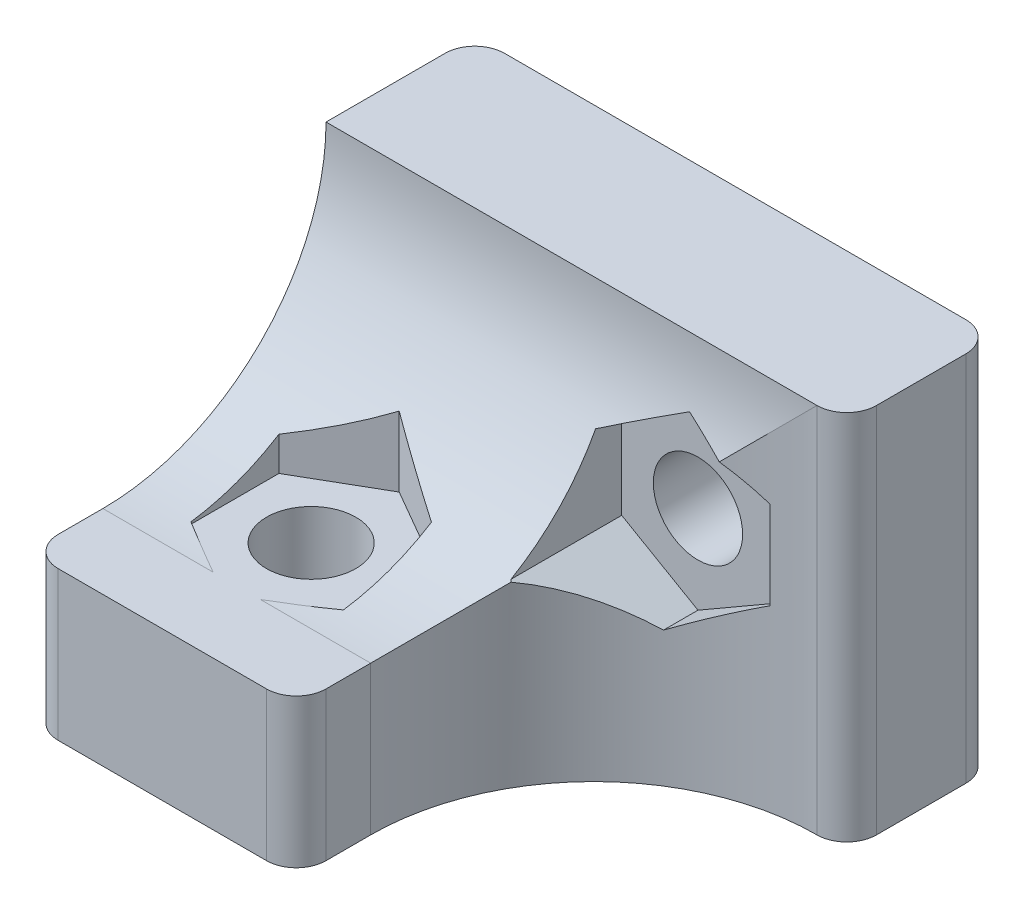
from build123d import *

# Parameters (mm, degrees)
SKETCH1_W           = 35
SKETCH1_H           = 25
BOSS_EXTRUDE1_DEPTH = 10
SKETCH2_R           = 3
CUT_EXTRUDE1_DEPTH  = 24.717082451
SKETCH3_W           = 18
SKETCH3_H           = 10
BOSS_EXTRUDE2_DEPTH = 20
SKETCH4_R           = 3
CUT_EXTRUDE2_DEPTH  = 38.831864876
FILLET2_R           = 15
FILLET3_R           = 2
CUT_EXTRUDE3_START  = -10
CUT_EXTRUDE3_DEPTH  = 27.912057753
CUT_EXTRUDE4_START  = -10
CUT_EXTRUDE4_DEPTH  = 33.793107057


# Some blends are built 0.0001 mm under size
with BuildPart() as part:
    # Sketch1 → Boss-Extrude1 (new body)
    with BuildSketch(Plane.XY):
        Rectangle(SKETCH1_W, SKETCH1_H)
    extrude(amount=BOSS_EXTRUDE1_DEPTH)

    # Sketch2 → Cut-Extrude1 (cut, through all)
    with BuildSketch(Plane.XY.offset(10)):
        with Locations((7.5, 2.5)):
            Circle(SKETCH2_R)
    extrude(amount=-CUT_EXTRUDE1_DEPTH, mode=Mode.SUBTRACT)

    # Sketch3 → Boss-Extrude2 (add)
    with BuildSketch(Plane.XY.offset(10)):
        with Locations((-8.5, -7.5)):
            Rectangle(SKETCH3_W, SKETCH3_H)
    extrude(amount=BOSS_EXTRUDE2_DEPTH)

    # Sketch4 → Cut-Extrude2 (cut, through all)
    with BuildSketch(Plane(origin=(0, -2.5, 0), x_dir=(1, 0, 0), z_dir=(0, 1, 0))):
        with Locations(Location((-8.5, -20, 0), (0, 0, 180))):
            Circle(SKETCH4_R)
    extrude(amount=-CUT_EXTRUDE2_DEPTH, mode=Mode.SUBTRACT)

    # Fillet2
    # the kernel refuses this fillet: 15 mm, written as the material it adds along each edge
    with BuildSketch(Plane(origin=(-17.5, -2.5, 10), x_dir=(0, 1, 0), z_dir=(1, 0, 0))) as fillet2_piece_1_section:
        with BuildLine():
            CenterArc((FILLET2_R, FILLET2_R), FILLET2_R, 180, 90)
            Line((0, FILLET2_R), (0, 0))
            Line((0, 0), (FILLET2_R, 0))
        make_face()
    fillet2_piece_1 = extrude(amount=18, mode=Mode.PRIVATE)
    fillet2_piece_1 = fillet2_piece_1 - Plane(origin=(-8.5, 1.000391612, 20), x_dir=(-1, 0, 0), z_dir=(0, 1, 0)) * Cylinder(3, 96, mode=Mode.PRIVATE)
    add(fillet2_piece_1)
    with BuildSketch(Plane(origin=(0.5, -2.5, 10), x_dir=(1, 0, 0), z_dir=(0, -1, 0))) as fillet2_piece_2:
        with BuildLine():
            CenterArc((FILLET2_R, FILLET2_R), FILLET2_R, 180, 90)
            Line((0, FILLET2_R), (0, 0))
            Line((0, 0), (FILLET2_R, 0))
        make_face()
    extrude(amount=10)
    with BuildSketch(Plane(origin=(-17.5, -2.5, 10), x_dir=(0, 1, 0), z_dir=(1, 0, 0))) as fillet2_piece_3a_section:
        with BuildLine():
            CenterArc((FILLET2_R, FILLET2_R), FILLET2_R, 180, 90)
            Line((0, FILLET2_R), (0, 0))
            Line((0, 0), (FILLET2_R, 0))
        make_face()
    fillet2_piece_3a = extrude(amount=55.5, mode=Mode.PRIVATE)
    fillet2_piece_3a = split(fillet2_piece_3a, bisect_by=Plane(origin=(17.5, 8.593163467, 10.419487564), z_dir=(-1, 0, 0)), keep=Keep.TOP, mode=Mode.PRIVATE)
    fillet2_piece_3a = fillet2_piece_3a - Plane(origin=(7.5, 2.5, 10.419487564), x_dir=(1, 0, 0), z_dir=(0, 0, 1)) * Cylinder(3, 171, mode=Mode.PRIVATE)
    fillet2_piece_3a = split(fillet2_piece_3a, bisect_by=Plane(origin=(0.5, 8.593163467, 10.419487564), z_dir=(1, 0, 0)), keep=Keep.TOP, mode=Mode.PRIVATE)
    with BuildSketch(Plane(origin=(0.5, 35, 10), x_dir=(1, 0, 0), z_dir=(0, -1, 0))) as fillet2_piece_3b_section:
        with BuildLine():
            CenterArc((FILLET2_R, FILLET2_R), FILLET2_R, 180, 90)
            Line((0, FILLET2_R), (0, 0))
            Line((0, 0), (FILLET2_R, 0))
        make_face()
    fillet2_piece_3b = extrude(amount=47.5, mode=Mode.PRIVATE)
    fillet2_piece_3b = split(fillet2_piece_3b, bisect_by=Plane(origin=(3.591954859, 12.5, 13.608813205), z_dir=(0, -1, 0)), keep=Keep.TOP, mode=Mode.PRIVATE)
    fillet2_piece_3b = fillet2_piece_3b - Plane(origin=(7.5, 2.5, 13.608813205), x_dir=(1, 0, 0), z_dir=(0, 0, 1)) * Cylinder(3, 155, mode=Mode.PRIVATE)
    fillet2_piece_3b = split(fillet2_piece_3b, bisect_by=Plane(origin=(3.591954859, -2.5, 13.608813205), z_dir=(0, 1, 0)), keep=Keep.TOP, mode=Mode.PRIVATE)
    fillet2_piece_3 = fillet2_piece_3a & fillet2_piece_3b
    add(fillet2_piece_3)

    # Fillet3
    fillet3_edges = [part.edges().sort_by_distance(p)[0] for p in [
        (17.5, 0, 0),
        (-17.5, 0, 0),
        (-17.5, -7.5, 30),
        (0.5, -7.5, 30),
        (17.5, 0, 10),
    ]]
    fillet(fillet3_edges, radius=FILLET3_R - 0.0001)  # a hair under: the kernel refuses the full size

    # Sketch5 → Cut-Extrude3 (cut, through all)
    with BuildSketch(Plane(origin=(0, 0, 0), x_dir=(-1, 0, 0), z_dir=(0, 0, -1)).offset(CUT_EXTRUDE3_START)):
        Polygon((-7.5, -3.417840259), (-2.375, -0.45892013), (-2.375, 5.45892013), (-7.5, 8.417840259), (-12.625, 5.45892013), (-12.625, -0.45892013), align=None)
    extrude(amount=-CUT_EXTRUDE3_DEPTH, mode=Mode.SUBTRACT)

    # Sketch6 → Cut-Extrude4 (cut, through all)
    with BuildSketch(Plane.XZ.offset(12.5).offset(CUT_EXTRUDE4_START)):
        Polygon((-8.5, 14.082159741), (-3.375, 17.04107987), (-3.375, 22.95892013), (-8.5, 25.917840259), (-13.625, 22.95892013), (-13.625, 17.04107987), align=None)
    extrude(amount=-CUT_EXTRUDE4_DEPTH, mode=Mode.SUBTRACT)


solid = part.part
